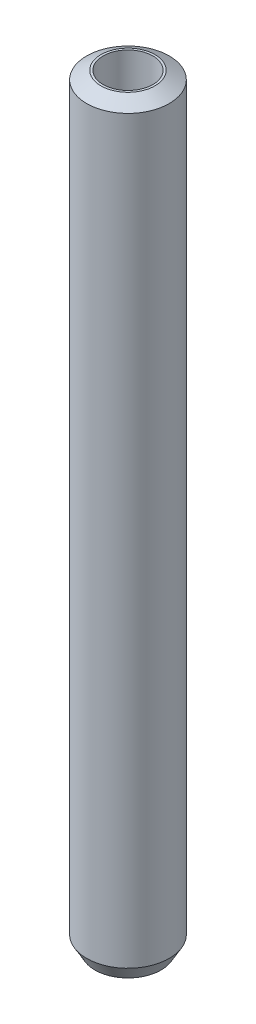
from build123d import *
from OCP.BRepFilletAPI import BRepFilletAPI_MakeChamfer

# Parameters (mm, degrees)
SKETCH1_R           = 17.5
BOSS_EXTRUDE1_DEPTH = 323.305458174
SKETCH2_R           = 10.533751529
CUT_EXTRUDE1_DEPTH  = 325.251321177
CHAMFER1_SIZE       = 3.482956892
CHAMFER1_SIZE2      = 6.032658298


with BuildPart() as part:
    # Sketch1 → Boss-Extrude1 (new body)
    with BuildSketch(Plane(origin=(0, 0, 0), x_dir=(1, 0, 0), z_dir=(0, 1, 0))):
        Circle(SKETCH1_R)
    extrude(amount=BOSS_EXTRUDE1_DEPTH)

    # Sketch2 → Cut-Extrude1 (cut, through all)
    with BuildSketch(Plane(origin=(0, 0, 0), x_dir=(1, 0, 0), z_dir=(0, 1, 0))):
        Circle(SKETCH2_R)
    extrude(amount=CUT_EXTRUDE1_DEPTH, mode=Mode.SUBTRACT)

    # Chamfer1: one chamfer whose edges measure the first distance from different faces: ONE call of the kernel's chamfer builder (chamfer() names one face for all edges)
    chamfer1_edges_1 = [part.edges().sort_by_distance(p)[0] for p in [
        (-17.5, 323.305458174, 0),
    ]]
    chamfer1_side_1 = [part.faces().sort_by_distance(p)[0] for p in [
        (-17.5, 161.652729087, 0),
    ]]
    chamfer1_edges_2 = [part.edges().sort_by_distance(p)[0] for p in [
        (-17.5, 0, 0),
    ]]
    chamfer1_side_2 = [part.faces().sort_by_distance(p)[0] for p in [
        (-17.005025253, 0, 0),
    ]]
    chamfer1 = BRepFilletAPI_MakeChamfer(part.part.solid().wrapped)
    for e in chamfer1_edges_1:
        chamfer1.Add(CHAMFER1_SIZE, CHAMFER1_SIZE2, e.wrapped, chamfer1_side_1[0].wrapped)  # the first distance lies on this face
    for e in chamfer1_edges_2:
        chamfer1.Add(CHAMFER1_SIZE, CHAMFER1_SIZE2, e.wrapped, chamfer1_side_2[0].wrapped)  # the first distance lies on this face
    add(Compound.cast(chamfer1.Shape()), mode=Mode.REPLACE)


solid = part.part
